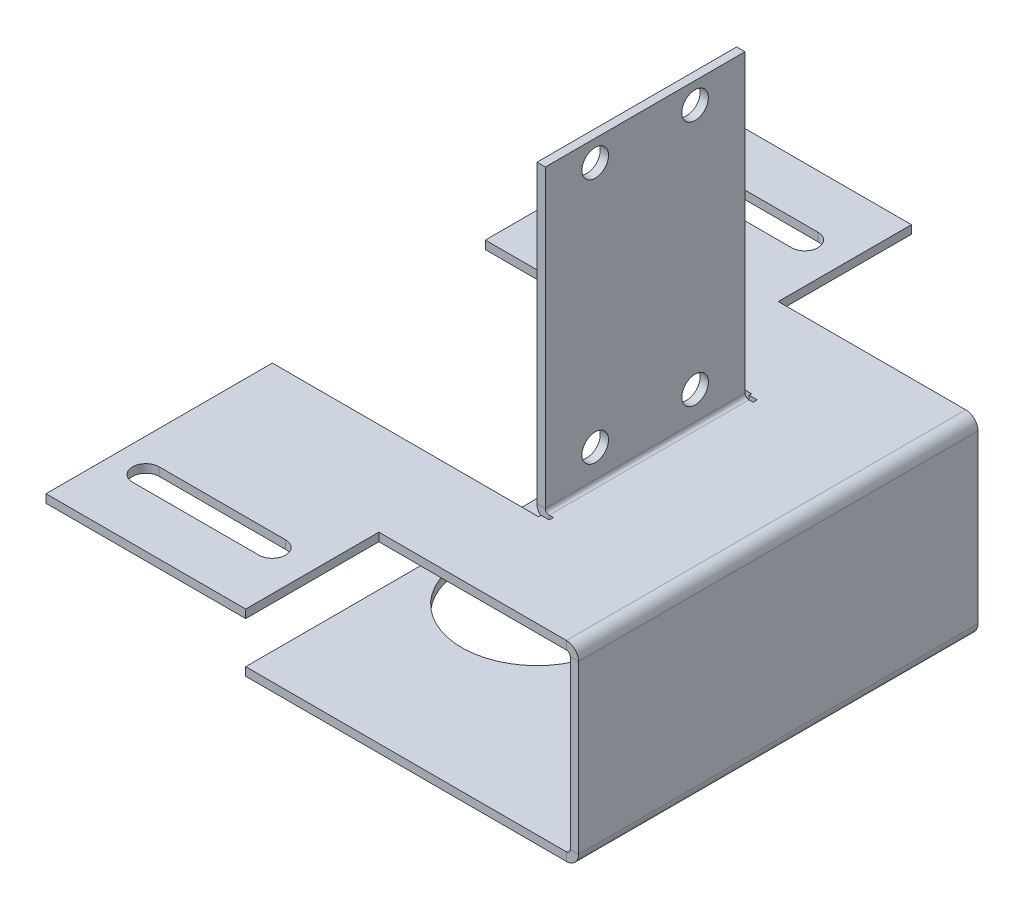
from build123d import *

# Parameters (mm, degrees)
BASE_FLANGE1_DEPTH            = 38.1
SKETCH4_W                     = 50.8
SKETCH4_H                     = 17.78
TAB1_DEPTH                    = 1.5875
SKETCH5_W                     = 50.8
SKETCH5_H                     = 17.78
TAB2_DEPTH                    = 1.5875
EDGE_FLANGE4_STRIP_W          = 7.8232
EDGE_FLANGE4_STRIP_H          = 1.5875
EDGE_FLANGE4_STRIP_CUT_DEPTH  = 38.1
EDGE_FLANGE4_RELIEF_W         = 8.61695
EDGE_FLANGE4_RELIEF_H         = 0.79375
EDGE_FLANGE4_RELIEF_CUT_DEPTH = 1.5875
EDGE_FLANGE4_DEPTH            = 38.1
SKETCH18_R                    = 14.351
CUT_EXTRUDE1_DEPTH            = 110.605811015
SKETCH19_W                    = 38.1
SKETCH19_H                    = 25.4
TAB3_DEPTH                    = 1.5875
SKETCH20_W                    = 38.1
SKETCH20_H                    = 25.4
TAB4_DEPTH                    = 1.5875
SKETCH21_R                    = 2.54
CUT_EXTRUDE2_DEPTH            = 117.856930597
CUT_EXTRUDE4_DEPTH            = 97.862741461


# Sheet-metal steps are written as plain solids
with BuildPart() as part:
    # Sketch1 → Base-Flange1 (new, symmetric)
    with BuildSketch(Plane.XY):
        with BuildLine():
            Line((5.148952002, 26.77051137), (28.224852002, 26.77051137))
            ThreePointArc((28.224852002, 26.77051137), (29.868238872, 26.08979824), (30.548952002, 24.44641137))
            Line((30.548952002, 24.44641137), (30.548952002, -7.41788863))
            ThreePointArc((30.548952002, -7.41788863), (29.868238872, -9.061275501), (28.224852002, -9.74198863))
            Line((28.224852002, -9.74198863), (-32.951047998, -9.74198863))
            Line((-32.951047998, -9.74198863), (-32.951047998, -8.15448863))
            Line((-32.951047998, -8.15448863), (28.224852002, -8.15448863))
            ThreePointArc((28.224852002, -8.15448863), (28.745706857, -7.938743485), (28.961452002, -7.41788863))
            Line((28.961452002, -7.41788863), (28.961452002, 24.44641137))
            ThreePointArc((28.961452002, 24.44641137), (28.745706857, 24.967266225), (28.224852002, 25.18301137))
            Line((28.224852002, 25.18301137), (5.148952002, 25.18301137))
            Line((5.148952002, 25.18301137), (5.148952002, 26.77051137))
        make_face()
    extrude(amount=BASE_FLANGE1_DEPTH, both=True)

    # Sketch4 → Tab1 (add)
    with BuildSketch(Plane(origin=(0, 26.77051137, 0), x_dir=(1, 0, 0), z_dir=(0, 1, 0))):
        with Locations((-20.251047998, -29.21)):
            Rectangle(SKETCH4_W, SKETCH4_H)
    extrude(amount=-TAB1_DEPTH)

    # Sketch5 → Tab2 (add)
    with BuildSketch(Plane(origin=(0, 26.77051137, 0), x_dir=(1, 0, 0), z_dir=(0, 1, 0))):
        with Locations((-20.251047998, 29.21)):
            Rectangle(SKETCH5_W, SKETCH5_H)
    extrude(amount=-TAB2_DEPTH)

    # Edge-Flange4 strip (across the edge) → Edge-Flange4 strip cut (cut)
    with BuildSketch(Plane(origin=(5.148952002, 26.77051137, -19.05), x_dir=(1, 0, 0), z_dir=(0, 0, 1))):
        with Locations((-3.175, -0.79375)):
            Rectangle(EDGE_FLANGE4_STRIP_W, EDGE_FLANGE4_STRIP_H)
    extrude(amount=EDGE_FLANGE4_STRIP_CUT_DEPTH, mode=Mode.SUBTRACT)

    # Edge-Flange4 relief (on the sheet) → Edge-Flange4 relief cut (cut)
    with BuildSketch(Plane(origin=(5.885552002, 26.77051137, -19.05), x_dir=(1, 0, 0), z_dir=(0, 1, 0))):
        with Locations((-3.514725, 0.396875)):
            Rectangle(EDGE_FLANGE4_RELIEF_W, EDGE_FLANGE4_RELIEF_H)
        with Locations((-3.514725, -38.496875)):
            Rectangle(EDGE_FLANGE4_RELIEF_W, EDGE_FLANGE4_RELIEF_H)
    extrude(amount=-EDGE_FLANGE4_RELIEF_CUT_DEPTH, mode=Mode.SUBTRACT)

    # Edge-Flange4 section (across the edge) → Edge-Flange4 (add)
    with BuildSketch(Plane(origin=(5.148952002, 26.77051137, -19.05), x_dir=(1, 0, 0), z_dir=(0, 0, 1))):
        with BuildLine():
            Line((-1.5875, 0.7366), (-1.5875, 57.15))
            Line((-1.5875, 57.15), (0, 57.15))
            Line((0, 57.15), (0, 0.7366))
            ThreePointArc((0, 0.7366), (0.215745145, 0.215745145), (0.7366, 0))
            Line((0.7366, 0), (0.7366, -1.5875))
            ThreePointArc((0.7366, -1.5875), (-0.90678687, -0.90678687), (-1.5875, 0.7366))
        make_face()
    extrude(amount=EDGE_FLANGE4_DEPTH)

    # Sketch18 → Cut-Extrude1 (cut, through all)
    with BuildSketch(Plane(origin=(0, -8.15448863, 0), x_dir=(1, 0, 0), z_dir=(0, 1, 0))):
        with Locations(Location((-15.488547998, 0, 0), (0, 0, 180))):
            Circle(SKETCH18_R)
    extrude(amount=-CUT_EXTRUDE1_DEPTH, mode=Mode.SUBTRACT)

    # Sketch19 → Tab3 (add)
    with BuildSketch(Plane(origin=(0, 26.77051137, 0), x_dir=(1, 0, 0), z_dir=(0, 1, 0))):
        with Locations((-26.601047998, -50.8)):
            Rectangle(SKETCH19_W, SKETCH19_H)
    extrude(amount=-TAB3_DEPTH)

    # Sketch20 → Tab4 (add)
    with BuildSketch(Plane(origin=(0, 26.77051137, 0), x_dir=(1, 0, 0), z_dir=(0, 1, 0))):
        with Locations((-26.601047998, 50.8)):
            Rectangle(SKETCH20_W, SKETCH20_H)
    extrude(amount=-TAB4_DEPTH)

    # Sketch21 → Cut-Extrude2 (cut, through all)
    with BuildSketch(Plane(origin=(5.148952002, 0, 0), x_dir=(0, 0, -1), z_dir=(1, 0, 0))):
        with Locations(Location((-9.525, 32.86651137, 0), (0, 0, 90))):
            Circle(SKETCH21_R)
        with Locations(Location((9.525, 32.86651137, 0), (0, 0, 90))):
            Circle(SKETCH21_R)
        with Locations(Location((-9.525, 79.85651137, 0), (0, 0, 90))):
            Circle(SKETCH21_R)
        with Locations(Location((9.525, 79.85651137, 0), (0, 0, 90))):
            Circle(SKETCH21_R)
    extrude(amount=-CUT_EXTRUDE2_DEPTH, mode=Mode.SUBTRACT)

    # Sketch24 → Cut-Extrude4 (cut, through all)
    with BuildSketch(Plane(origin=(0, 26.77051137, 0), x_dir=(1, 0, 0), z_dir=(0, 1, 0))):
        with BuildLine():
            Line((-39.301047998, -48.26), (-15.19816231, -48.26))
            ThreePointArc((-15.19816231, -48.26), (-12.65816231, -50.8), (-15.19816231, -53.34))
            Line((-15.19816231, -53.34), (-39.301047998, -53.34))
            ThreePointArc((-39.301047998, -53.34), (-41.841047998, -50.8), (-39.301047998, -48.26))
        make_face()
    cut_extrude4 = extrude(amount=-CUT_EXTRUDE4_DEPTH, mode=Mode.SUBTRACT)

    # Mirror1: Cut-Extrude4 across plane
    add(cut_extrude4.mirror(Plane.XY), mode=Mode.SUBTRACT)


solid = part.part
